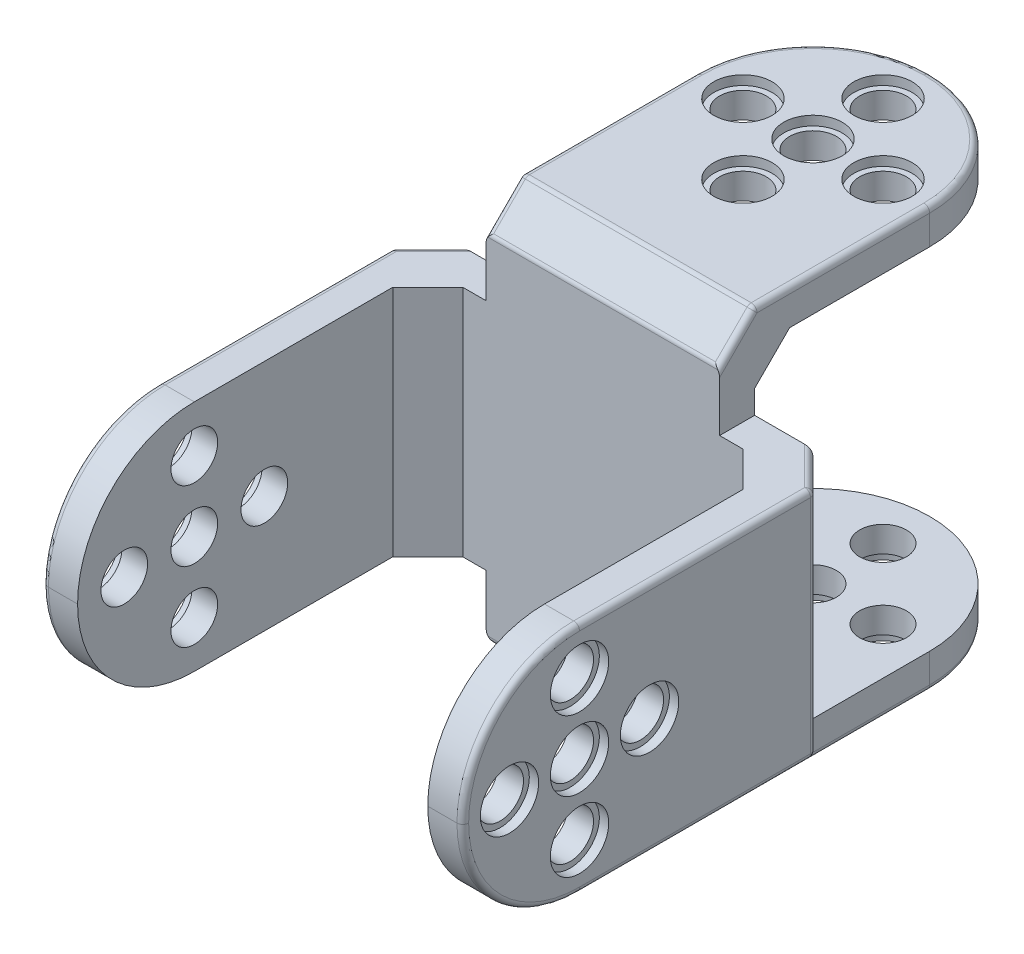
from build123d import *

# Parameters (mm, degrees)
SKETCH1_W                              = 36
SKETCH1_H                              = 20
SKETCH1_W_2                            = 20
SKETCH1_H_2                            = 36
BOSS_EXTRUDE1_DEPTH                    = 3
SKETCH2_W                              = 20
SKETCH2_H                              = 3
BOSS_EXTRUDE2_DEPTH                    = 25
CHAMFER1_SIZE                          = 3
FILLET1_R                              = 10
FILLET2_R                              = 10
CBORE_FOR_M5_HEX_HEAD_BOLT1_AT_2_COUNT = 2
CBORE_FOR_M5_HEX_HEAD_BOLT1_AT_2_PITCH = 6
CIRPATTERN1_COUNT                      = 4
FILLET1_OF_MIRROR1_R                   = 10
FILLET2_OF_MIRROR1_R                   = 10
CHAMFER2_SIZE                          = 3
SKETCH6_W                              = 3
SKETCH6_H                              = 20
BOSS_EXTRUDE3_DEPTH                    = 30
FILLET3_R                              = 10
FILLET4_R                              = 10
CBORE_FOR_M5_HEX_HEAD_BOLT2_AT_2_COUNT = 2
CBORE_FOR_M5_HEX_HEAD_BOLT2_AT_2_PITCH = 6
CIRPATTERN2_COUNT                      = 4
CHAMFER3_SIZE                          = 3
FILLET3_OF_MIRROR2_R                   = 10
FILLET4_OF_MIRROR2_R                   = 10
FILLET5_R                              = 0.5
CHAMFER5_SIZE                          = 3
FILLET6_R                              = 0.5
FILLET7_R                              = 0.5
FILLET8_R                              = 0.5


with BuildPart() as part:
    # Sketch1 → Boss-Extrude1 (new body)
    with BuildSketch(Plane.XY):
        Rectangle(SKETCH1_W, SKETCH1_H)
        Rectangle(SKETCH1_W_2, SKETCH1_H_2)
    extrude(amount=BOSS_EXTRUDE1_DEPTH)

    # Sketch2 → Boss-Extrude2 (add)
    with BuildSketch(Plane(origin=(0, 0, 0), x_dir=(-1, 0, 0), z_dir=(0, 0, -1))):
        with Locations((0, 16.5)):
            Rectangle(SKETCH2_W, SKETCH2_H)
    boss_extrude2 = extrude(amount=BOSS_EXTRUDE2_DEPTH)

    # Chamfer1
    chamfer1_edges = [part.edges().sort_by_distance(p)[0] for p in [
        (0, 18, 3),
        (0, 15, 0),
    ]]
    chamfer(chamfer1_edges, length=CHAMFER1_SIZE)

    # Fillet1
    fillet1_edges = [part.edges().sort_by_distance(p)[0] for p in [
        (10, 16.5, -25),
    ]]
    fillet(fillet1_edges, radius=FILLET1_R)

    # Fillet2
    fillet2_edges = [part.edges().sort_by_distance(p)[0] for p in [
        (-10, 16.5, -25),
    ]]
    fillet(fillet2_edges, radius=FILLET2_R - 0.0001)  # a hair under: the kernel refuses the full size

    # Sketch4 → CBORE for M5 Hex Head Bolt1 (revolve, cut)
    with BuildSketch(Plane(origin=(0, 18, -15), x_dir=(0, 0, 1), z_dir=(1, 0, 0))):
        Polygon((0, 0), (0, 5.178090033), (2, 4), (2, 0.8), (2.5, 0.8), (2.5, 0), align=None)
    cbore_for_m5_hex_head_bolt1 = revolve(axis=Axis((0, 24.35, -15), (0, -1, 0)), mode=Mode.SUBTRACT)

    # CBORE for M5 Hex Head Bolt1 at 2: CBORE for M5 Hex Head Bolt1 ×2
    with Locations(*[(0, 0, -i * CBORE_FOR_M5_HEX_HEAD_BOLT1_AT_2_PITCH) for i in range(1, CBORE_FOR_M5_HEX_HEAD_BOLT1_AT_2_COUNT)]):
        add(cbore_for_m5_hex_head_bolt1, mode=Mode.SUBTRACT)

    # CirPattern1: CBORE for M5 Hex Head Bolt1 ×4 about axis
    cirpattern1_axis = Axis((0, 0, -15), (0, 1, 0))
    for i in range(1, CIRPATTERN1_COUNT):
        add(cbore_for_m5_hex_head_bolt1.rotate(cirpattern1_axis, i * 360 / CIRPATTERN1_COUNT), mode=Mode.SUBTRACT)

    # CirPattern1 copy 1 sketch → CirPattern1 copy 1 (revolve, cut)
    with BuildSketch(Plane(origin=(-6, 18, -15), x_dir=(1, 0, 0), z_dir=(0, 0, -1))):
        Polygon((0, 0), (0, 5.178090033), (2, 4), (2, 0.8), (2.5, 0.8), (2.5, 0), align=None)
    revolve(axis=Axis((-6, 24.35, -15), (0, -1, 0)), mode=Mode.SUBTRACT)

    # CirPattern1 copy 2 sketch → CirPattern1 copy 2 (revolve, cut)
    with BuildSketch(Plane(origin=(0, 18, -9), x_dir=(0, 0, -1), z_dir=(-1, 0, 0))):
        Polygon((0, 0), (0, 5.178090033), (2, 4), (2, 0.8), (2.5, 0.8), (2.5, 0), align=None)
    revolve(axis=Axis((0, 24.35, -9), (0, -1, 0)), mode=Mode.SUBTRACT)

    # CirPattern1 copy 3 sketch → CirPattern1 copy 3 (revolve, cut)
    with BuildSketch(Plane(origin=(6, 18, -15), x_dir=(-1, 0, 0), z_dir=(0, 0, 1))):
        Polygon((0, 0), (0, 5.178090033), (2, 4), (2, 0.8), (2.5, 0.8), (2.5, 0), align=None)
    revolve(axis=Axis((6, 24.35, -15), (0, -1, 0)), mode=Mode.SUBTRACT)

    # Mirror1: Boss-Extrude2, CBORE for M5 Hex Head Bolt1 across plane
    add(boss_extrude2.mirror(Plane.ZX))
    add(cbore_for_m5_hex_head_bolt1.mirror(Plane.ZX), mode=Mode.SUBTRACT)

    # Mirror1 copy 1 sketch → Mirror1 copy 1 (revolve, cut)
    with BuildSketch(Plane(origin=(0, -18, -21), x_dir=(0, 0, 1), z_dir=(1, 0, 0))):
        Polygon((0, 0), (0, -5.178090033), (2, -4), (2, -0.8), (2.5, -0.8), (2.5, 0), align=None)
    revolve(axis=Axis((0, -24.35, -21), (0, -1, 0)), mode=Mode.SUBTRACT)

    # Mirror1 copy 2 sketch → Mirror1 copy 2 (revolve, cut)
    with BuildSketch(Plane(origin=(0, -18, -15), x_dir=(1, 0, 0), z_dir=(0, 0, -1))):
        Polygon((0, 0), (0, -5.178090033), (2, -4), (2, -0.8), (2.5, -0.8), (2.5, 0), align=None)
    revolve(axis=Axis((0, -24.35, -15), (0, -1, 0)), mode=Mode.SUBTRACT)

    # Mirror1 copy 3 sketch → Mirror1 copy 3 (revolve, cut)
    with BuildSketch(Plane(origin=(0, -18, -15), x_dir=(0, 0, -1), z_dir=(-1, 0, 0))):
        Polygon((0, 0), (0, -5.178090033), (2, -4), (2, -0.8), (2.5, -0.8), (2.5, 0), align=None)
    revolve(axis=Axis((0, -24.35, -15), (0, -1, 0)), mode=Mode.SUBTRACT)

    # Mirror1 copy 4 sketch → Mirror1 copy 4 (revolve, cut)
    with BuildSketch(Plane(origin=(0, -18, -15), x_dir=(-1, 0, 0), z_dir=(0, 0, 1))):
        Polygon((0, 0), (0, -5.178090033), (2, -4), (2, -0.8), (2.5, -0.8), (2.5, 0), align=None)
    revolve(axis=Axis((0, -24.35, -15), (0, -1, 0)), mode=Mode.SUBTRACT)

    # Mirror1 copy 5 sketch → Mirror1 copy 5 (revolve, cut)
    with BuildSketch(Plane(origin=(-6, -18, -15), x_dir=(1, 0, 0), z_dir=(0, 0, -1))):
        Polygon((0, 0), (0, -5.178090033), (2, -4), (2, -0.8), (2.5, -0.8), (2.5, 0), align=None)
    revolve(axis=Axis((-6, -24.35, -15), (0, -1, 0)), mode=Mode.SUBTRACT)

    # Mirror1 copy 6 sketch → Mirror1 copy 6 (revolve, cut)
    with BuildSketch(Plane(origin=(0, -18, -9), x_dir=(0, 0, -1), z_dir=(-1, 0, 0))):
        Polygon((0, 0), (0, -5.178090033), (2, -4), (2, -0.8), (2.5, -0.8), (2.5, 0), align=None)
    revolve(axis=Axis((0, -24.35, -9), (0, -1, 0)), mode=Mode.SUBTRACT)

    # Mirror1 copy 7 sketch → Mirror1 copy 7 (revolve, cut)
    with BuildSketch(Plane(origin=(6, -18, -15), x_dir=(-1, 0, 0), z_dir=(0, 0, 1))):
        Polygon((0, 0), (0, -5.178090033), (2, -4), (2, -0.8), (2.5, -0.8), (2.5, 0), align=None)
    revolve(axis=Axis((6, -24.35, -15), (0, -1, 0)), mode=Mode.SUBTRACT)

    # Fillet1 of Mirror1
    fillet1_of_mirror1_edges = [part.edges().sort_by_distance(p)[0] for p in [
        (10, -16.5, -25),
    ]]
    fillet(fillet1_of_mirror1_edges, radius=FILLET1_OF_MIRROR1_R)

    # Fillet2 of Mirror1
    fillet2_of_mirror1_edges = [part.edges().sort_by_distance(p)[0] for p in [
        (-10, -16.5, -25),
    ]]
    fillet(fillet2_of_mirror1_edges, radius=FILLET2_OF_MIRROR1_R - 0.0001)  # a hair under: the kernel refuses the full size

    # Chamfer2
    chamfer2_edges = [part.edges().sort_by_distance(p)[0] for p in [
        (0, -15, 0),
        (0, -18, 3),
    ]]
    chamfer(chamfer2_edges, length=CHAMFER2_SIZE)

    # Sketch6 → Boss-Extrude3 (add)
    with BuildSketch(Plane.XY.offset(3)):
        with Locations((16.5, 0)):
            Rectangle(SKETCH6_W, SKETCH6_H)
    boss_extrude3 = extrude(amount=BOSS_EXTRUDE3_DEPTH)

    # Fillet3
    fillet3_edges = [part.edges().sort_by_distance(p)[0] for p in [
        (16.5, 10, 33),
    ]]
    fillet(fillet3_edges, radius=FILLET3_R)

    # Fillet4
    fillet4_edges = [part.edges().sort_by_distance(p)[0] for p in [
        (16.5, -10, 33),
    ]]
    fillet(fillet4_edges, radius=FILLET4_R - 0.0001)  # a hair under: the kernel refuses the full size

    # Sketch9 → CBORE for M5 Hex Head Bolt2 (revolve, cut)
    with BuildSketch(Plane(origin=(18, 0, 23), x_dir=(0, 0, -1), z_dir=(0, 1, 0))):
        Polygon((0, 0), (0, 5.178090033), (2, 4), (2, 0.8), (2.5, 0.8), (2.5, 0), align=None)
    cbore_for_m5_hex_head_bolt2 = revolve(axis=Axis((24.35, 0, 23), (-1, 0, 0)), mode=Mode.SUBTRACT)

    # CBORE for M5 Hex Head Bolt2 at 2: CBORE for M5 Hex Head Bolt2 ×2
    with Locations(*[(0, 0, i * CBORE_FOR_M5_HEX_HEAD_BOLT2_AT_2_PITCH) for i in range(1, CBORE_FOR_M5_HEX_HEAD_BOLT2_AT_2_COUNT)]):
        add(cbore_for_m5_hex_head_bolt2, mode=Mode.SUBTRACT)

    # CirPattern2: CBORE for M5 Hex Head Bolt2 ×4 about axis
    cirpattern2_axis = Axis((0, 0, 23), (1, 0, 0))
    for i in range(1, CIRPATTERN2_COUNT):
        add(cbore_for_m5_hex_head_bolt2.rotate(cirpattern2_axis, i * 360 / CIRPATTERN2_COUNT), mode=Mode.SUBTRACT)

    # CirPattern2 copy 1 sketch → CirPattern2 copy 1 (revolve, cut)
    with BuildSketch(Plane(origin=(18, -6, 23), x_dir=(0, 1, 0), z_dir=(0, 0, 1))):
        Polygon((0, 0), (0, 5.178090033), (2, 4), (2, 0.8), (2.5, 0.8), (2.5, 0), align=None)
    revolve(axis=Axis((24.35, -6, 23), (-1, 0, 0)), mode=Mode.SUBTRACT)

    # CirPattern2 copy 2 sketch → CirPattern2 copy 2 (revolve, cut)
    with BuildSketch(Plane(origin=(18, 0, 17), x_dir=(0, 0, 1), z_dir=(0, -1, 0))):
        Polygon((0, 0), (0, 5.178090033), (2, 4), (2, 0.8), (2.5, 0.8), (2.5, 0), align=None)
    revolve(axis=Axis((24.35, 0, 17), (-1, 0, 0)), mode=Mode.SUBTRACT)

    # CirPattern2 copy 3 sketch → CirPattern2 copy 3 (revolve, cut)
    with BuildSketch(Plane(origin=(18, 6, 23), x_dir=(0, -1, 0), z_dir=(0, 0, -1))):
        Polygon((0, 0), (0, 5.178090033), (2, 4), (2, 0.8), (2.5, 0.8), (2.5, 0), align=None)
    revolve(axis=Axis((24.35, 6, 23), (-1, 0, 0)), mode=Mode.SUBTRACT)

    # Chamfer3
    chamfer3_edges = [part.edges().sort_by_distance(p)[0] for p in [
        (15, 0, 3),
        (18, 0, 0),
    ]]
    chamfer(chamfer3_edges, length=CHAMFER3_SIZE)

    # Mirror2: Boss-Extrude3, CBORE for M5 Hex Head Bolt2 across plane
    add(boss_extrude3.mirror(Plane(origin=(0, 0, 0), x_dir=(0, 0, 1), z_dir=(1, 0, 0))))
    add(cbore_for_m5_hex_head_bolt2.mirror(Plane(origin=(0, 0, 0), x_dir=(0, 0, 1), z_dir=(1, 0, 0))), mode=Mode.SUBTRACT)

    # Mirror2 copy 1 sketch → Mirror2 copy 1 (revolve, cut)
    with BuildSketch(Plane(origin=(-18, 0, 29), x_dir=(0, 0, -1), z_dir=(0, 1, 0))):
        Polygon((0, 0), (0, -5.178090033), (2, -4), (2, -0.8), (2.5, -0.8), (2.5, 0), align=None)
    revolve(axis=Axis((-24.35, 0, 29), (-1, 0, 0)), mode=Mode.SUBTRACT)

    # Mirror2 copy 2 sketch → Mirror2 copy 2 (revolve, cut)
    with BuildSketch(Plane(origin=(-18, 0, 23), x_dir=(0, 1, 0), z_dir=(0, 0, 1))):
        Polygon((0, 0), (0, -5.178090033), (2, -4), (2, -0.8), (2.5, -0.8), (2.5, 0), align=None)
    revolve(axis=Axis((-24.35, 0, 23), (-1, 0, 0)), mode=Mode.SUBTRACT)

    # Mirror2 copy 3 sketch → Mirror2 copy 3 (revolve, cut)
    with BuildSketch(Plane(origin=(-18, 0, 23), x_dir=(0, 0, 1), z_dir=(0, -1, 0))):
        Polygon((0, 0), (0, -5.178090033), (2, -4), (2, -0.8), (2.5, -0.8), (2.5, 0), align=None)
    revolve(axis=Axis((-24.35, 0, 23), (-1, 0, 0)), mode=Mode.SUBTRACT)

    # Mirror2 copy 4 sketch → Mirror2 copy 4 (revolve, cut)
    with BuildSketch(Plane(origin=(-18, 0, 23), x_dir=(0, -1, 0), z_dir=(0, 0, -1))):
        Polygon((0, 0), (0, -5.178090033), (2, -4), (2, -0.8), (2.5, -0.8), (2.5, 0), align=None)
    revolve(axis=Axis((-24.35, 0, 23), (-1, 0, 0)), mode=Mode.SUBTRACT)

    # Mirror2 copy 5 sketch → Mirror2 copy 5 (revolve, cut)
    with BuildSketch(Plane(origin=(-18, -6, 23), x_dir=(0, 1, 0), z_dir=(0, 0, 1))):
        Polygon((0, 0), (0, -5.178090033), (2, -4), (2, -0.8), (2.5, -0.8), (2.5, 0), align=None)
    revolve(axis=Axis((-24.35, -6, 23), (-1, 0, 0)), mode=Mode.SUBTRACT)

    # Mirror2 copy 6 sketch → Mirror2 copy 6 (revolve, cut)
    with BuildSketch(Plane(origin=(-18, 0, 17), x_dir=(0, 0, 1), z_dir=(0, -1, 0))):
        Polygon((0, 0), (0, -5.178090033), (2, -4), (2, -0.8), (2.5, -0.8), (2.5, 0), align=None)
    revolve(axis=Axis((-24.35, 0, 17), (-1, 0, 0)), mode=Mode.SUBTRACT)

    # Mirror2 copy 7 sketch → Mirror2 copy 7 (revolve, cut)
    with BuildSketch(Plane(origin=(-18, 6, 23), x_dir=(0, -1, 0), z_dir=(0, 0, -1))):
        Polygon((0, 0), (0, -5.178090033), (2, -4), (2, -0.8), (2.5, -0.8), (2.5, 0), align=None)
    revolve(axis=Axis((-24.35, 6, 23), (-1, 0, 0)), mode=Mode.SUBTRACT)

    # Fillet3 of Mirror2
    fillet3_of_mirror2_edges = [part.edges().sort_by_distance(p)[0] for p in [
        (-16.5, 10, 33),
    ]]
    fillet(fillet3_of_mirror2_edges, radius=FILLET3_OF_MIRROR2_R)

    # Fillet4 of Mirror2
    fillet4_of_mirror2_edges = [part.edges().sort_by_distance(p)[0] for p in [
        (-16.5, -10, 33),
    ]]
    fillet(fillet4_of_mirror2_edges, radius=FILLET4_OF_MIRROR2_R - 0.0001)  # a hair under: the kernel refuses the full size

    # Fillet5
    fillet5_edges = [part.edges().sort_by_distance(p)[0] for p in [
        (18, 10, 13),
        (18, 7.071067812, 30.071067812),
        (18, -10, 13.00005),
        (18, -7.071097101, 30.071097101),
        (15, 0, 0),
        (16.5, -10, 1.5),
        (18, 0, 3),
        (16.5, 10, 1.5),
    ]]
    fillet(fillet5_edges, radius=FILLET5_R)

    # Chamfer5
    chamfer5_edges = [part.edges().sort_by_distance(p)[0] for p in [
        (-18, 0, 0),
        (-15, 0, 3),
    ]]
    chamfer(chamfer5_edges, length=CHAMFER5_SIZE)

    # Fillet6
    fillet6_edges = [part.edges().sort_by_distance(p)[0] for p in [
        (-18, 10, 13),
        (-18, 7.071067812, 30.071067812),
        (-18, -10, 13.00005),
        (-18, -7.071097101, 30.071097101),
        (-18, 0, 3),
        (-16.5, -10, 1.5),
        (-15, 0, 0),
        (-16.5, 10, 1.5),
    ]]
    fillet(fillet6_edges, radius=FILLET6_R)

    # Fillet7
    fillet7_edges = [part.edges().sort_by_distance(p)[0] for p in [
        (10, 18, -7.5),
        (-10, 18, -7.50005),
        (0, 18, 0),
        (10, 16.5, 1.5),
        (0, 15, 3),
        (-10, 16.5, 1.5),
        (7.071067812, 18, -22.071067812),
        (-7.071097101, 18, -22.071097101),
    ]]
    fillet(fillet7_edges, radius=FILLET7_R)

    # Fillet8
    fillet8_edges = [part.edges().sort_by_distance(p)[0] for p in [
        (7.071067812, -18, -22.071067812),
        (-7.071097101, -18, -22.071097101),
        (0, -15, 3),
        (10, -18, -7.5),
        (10, -16.5, 1.5),
        (-10, -18, -7.50005),
        (0, -18, 0),
        (-10, -16.5, 1.5),
    ]]
    fillet(fillet8_edges, radius=FILLET8_R)


solid = part.part
